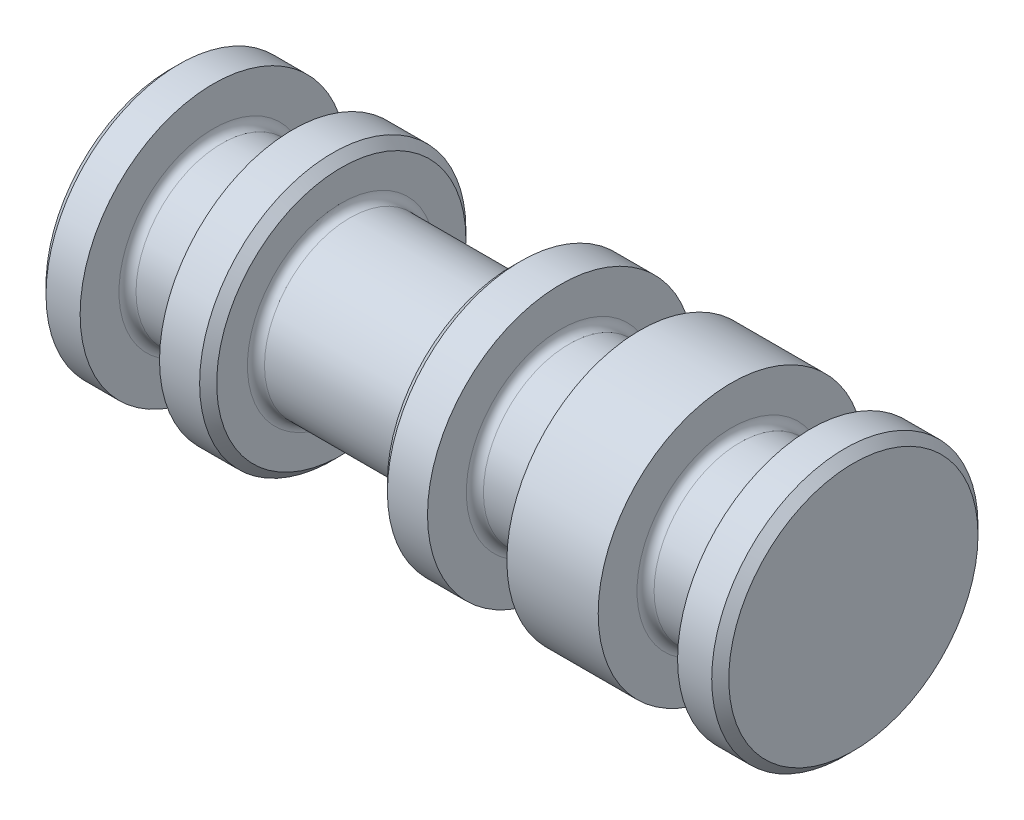
from build123d import *

# Parameters (mm, degrees)
SKETCH1_R           = 3.9624
BOSS_EXTRUDE1_DEPTH = 20.32
SKETCH2_W           = 2.3622
SKETCH2_H           = 1.4097
SKETCH2_W_2         = 5.08
SKETCH2_H_2         = 1.4224
FILLET1_R           = 0.254
CHAMFER1_SIZE       = 0.254


with BuildPart() as part:
    # Sketch1 → Boss-Extrude1 (new body)
    with BuildSketch(Plane(origin=(0, 0, 0), x_dir=(0, 0, -1), z_dir=(1, 0, 0))):
        Circle(SKETCH1_R)
    extrude(amount=BOSS_EXTRUDE1_DEPTH)

    # Sketch2 → Cut-Revolve1 (revolve, cut)
    with BuildSketch(Plane.XY):
        with Locations((2.4511, 3.25755)):
            Rectangle(SKETCH2_W, SKETCH2_H)
        with Locations((17.8689, 3.25755)):
            Rectangle(SKETCH2_W, SKETCH2_H)
        with Locations((12.7889, 3.25755)):
            Rectangle(SKETCH2_W, SKETCH2_H)
        with Locations((7.62, 3.2512)):
            Rectangle(SKETCH2_W_2, SKETCH2_H_2)
    revolve(axis=Axis((-1.617419624, 0, 0), (1, 0, 0)), mode=Mode.SUBTRACT)

    # Fillet1
    fillet1_edges = [part.edges().sort_by_distance(p)[0] for p in [
        (19.05, -2.5527, 0),
        (16.6878, -2.5527, 0),
        (13.97, -2.5527, 0),
        (11.6078, -2.5527, 0),
        (10.16, -2.54, 0),
        (5.08, -2.54, 0),
        (3.6322, -2.5527, 0),
        (1.27, -2.5527, 0),
    ]]
    fillet(fillet1_edges, radius=FILLET1_R)

    # Chamfer1
    chamfer1_edges = [part.edges().sort_by_distance(p)[0] for p in [
        (20.32, 0, 3.9624),
        (10.16, 0, 3.9624),
        (5.08, 0, 3.9624),
        (0, 0, 3.9624),
    ]]
    chamfer(chamfer1_edges, length=CHAMFER1_SIZE)


solid = part.part
